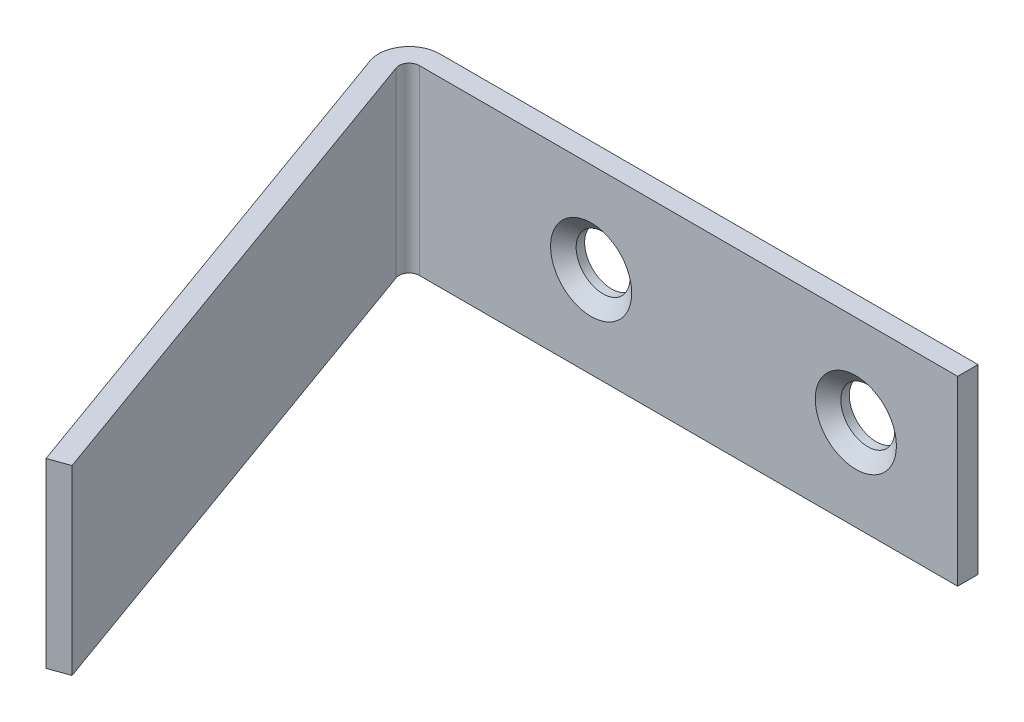
from build123d import *

# Parameters (mm, degrees)
EXTRUDE_THIN1_START = -7.9375
EXTRUDE_THIN1_DEPTH = 15.875
SKETCH4_R           = 2.3495
EXTRUDE3_DEPTH      = 67.428185443


# Read off the part's stored shape, not the designer's step: Extrude-Thin1
with BuildPart() as part:
    # Extrude-Thin1 outline → Extrude-Thin1 (new body)
    with BuildSketch(Plane(origin=(0, 0, 0), x_dir=(1, 0, 0), z_dir=(0, 1, 0)).offset(EXTRUDE_THIN1_START)):
        with BuildLine():
            Line((3.79480894, -1.778), (50.8, -1.778))
            Line((50.8, -1.778), (50.8, 0))
            Line((50.8, 0), (3.79480894, 0))
            ThreePointArc((3.79480894, 0), (1.6127938, -1.133475), (1.285491529, -3.57044625))
            Line((1.285491529, -3.57044625), (17.2085, -47.79652213))
            Line((17.2085, -47.79652213), (18.881378275, -47.19422463))
            Line((18.881378275, -47.19422463), (2.958369803, -2.96814875))
            ThreePointArc((2.958369803, -2.96814875), (3.06747056, -2.155825), (3.79480894, -1.778))
        make_face()
    extrude(amount=EXTRUDE_THIN1_DEPTH)

    # Sketch4 → Extrude3 (cut, through all)
    with BuildSketch(Plane(origin=(3.556, 0, 1.778), x_dir=(1, 0, 0), z_dir=(0, 0, 1))):
        with Locations((38.354, 0)):
            Circle(SKETCH4_R)
        with Locations((15.24, 0)):
            Circle(SKETCH4_R)
    extrude(amount=-EXTRUDE3_DEPTH, mode=Mode.SUBTRACT)

    # Cut-Extrude1 cone 1 section (through the dimple's axis) → Cut-Extrude1 (revolve, cut)
    with BuildSketch(Plane(origin=(41.91, 0, 1.778), x_dir=(0, -1, 0), z_dir=(1, 0, 0))):
        Polygon((0, 0), (3.5433, 0), (0, 3.080143698), align=None)
    revolve(axis=Axis((41.91, 0, 1.778), (0, 0, -1)), mode=Mode.SUBTRACT)

    # Cut-Extrude1 cone 2 section (through the dimple's axis) → Cut-Extrude1 cone 2 (revolve, cut)
    with BuildSketch(Plane(origin=(18.796, 0, 1.778), x_dir=(0, -1, 0), z_dir=(1, 0, 0))):
        Polygon((0, 0), (3.5433, 0), (0, 3.080143698), align=None)
    revolve(axis=Axis((18.796, 0, 1.778), (0, 0, -1)), mode=Mode.SUBTRACT)


solid = part.part
